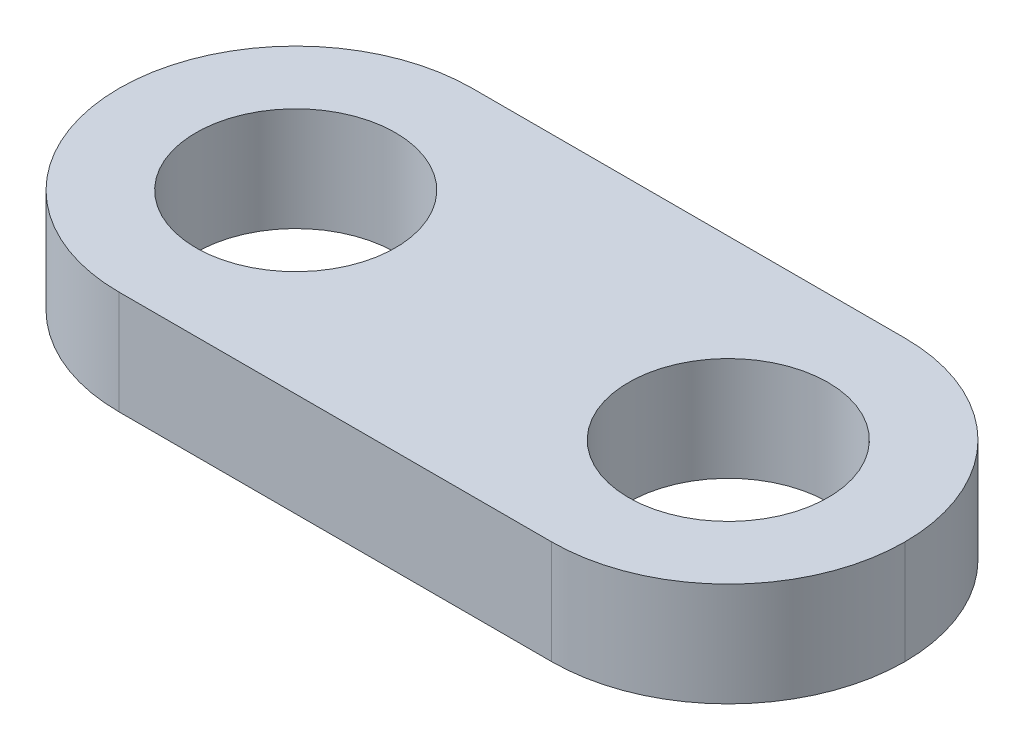
from build123d import *

# Parameters (mm, degrees)
SKETCH1_W           = 17.8
SKETCH1_H           = 8
BOSS_EXTRUDE1_DEPTH = 2.35
SKETCH2_R           = 2.26
CUT_EXTRUDE1_DEPTH  = 20.656105922
FILLET1_R           = 4


with BuildPart() as part:
    # Sketch1 → Boss-Extrude1 (new body)
    with BuildSketch(Plane(origin=(0, 0, 0), x_dir=(1, 0, 0), z_dir=(0, 1, 0))):
        with Locations((8.9, 4)):
            Rectangle(SKETCH1_W, SKETCH1_H)
    extrude(amount=BOSS_EXTRUDE1_DEPTH)

    # Sketch2 → Cut-Extrude1 (cut, through all)
    with BuildSketch(Plane(origin=(0, 2.35, 0), x_dir=(1, 0, 0), z_dir=(0, 1, 0))):
        with Locations(Location((4, 4, 0), (0, 0, 270))):
            Circle(SKETCH2_R)
        with Locations(Location((13.8, 4, 0), (0, 0, 270))):
            Circle(SKETCH2_R)
    extrude(amount=-CUT_EXTRUDE1_DEPTH, mode=Mode.SUBTRACT)

    # Fillet1
    fillet1_edges = [part.edges().sort_by_distance(p)[0] for p in [
        (17.8, 1.175, 0),
        (0, 1.175, 0),
        (17.8, 1.175, -8),
        (0, 1.175, -8),
    ]]
    fillet(fillet1_edges, radius=FILLET1_R - 0.0001)  # a hair under: the kernel refuses the full size


solid = part.part
